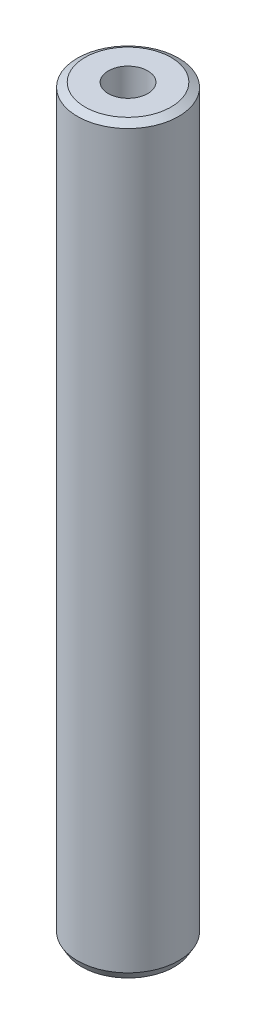
from build123d import *
from OCP.BRepFilletAPI import BRepFilletAPI_MakeChamfer

# Parameters (mm, degrees)
SKETCH1_R           = 37.5
BOSS_EXTRUDE1_DEPTH = 550.928941752
SKETCH2_R           = 14.639786321
CUT_EXTRUDE1_DEPTH  = 554.475563019
CHAMFER1_SIZE       = 3.236210435
CHAMFER1_SIZE2      = 5.605280897


with BuildPart() as part:
    # Sketch1 → Boss-Extrude1 (new body)
    with BuildSketch(Plane(origin=(0, 0, 0), x_dir=(1, 0, 0), z_dir=(0, 1, 0))):
        Circle(SKETCH1_R)
    extrude(amount=BOSS_EXTRUDE1_DEPTH)

    # Sketch2 → Cut-Extrude1 (cut, through all)
    with BuildSketch(Plane(origin=(0, 0, 0), x_dir=(1, 0, 0), z_dir=(0, 1, 0))):
        Circle(SKETCH2_R)
    extrude(amount=CUT_EXTRUDE1_DEPTH, mode=Mode.SUBTRACT)

    # Chamfer1: one chamfer whose edges measure the first distance from different faces: ONE call of the kernel's chamfer builder (chamfer() names one face for all edges)
    chamfer1_edges_1 = [part.edges().sort_by_distance(p)[0] for p in [
        (-37.5, 550.928941752, 0),
    ]]
    chamfer1_side_1 = [part.faces().sort_by_distance(p)[0] for p in [
        (-37.5, 275.464470876, 0),
    ]]
    chamfer1_edges_2 = [part.edges().sort_by_distance(p)[0] for p in [
        (-37.5, 0, 0),
    ]]
    chamfer1_side_2 = [part.faces().sort_by_distance(p)[0] for p in [
        (-36.439339828, 0, 0),
    ]]
    chamfer1 = BRepFilletAPI_MakeChamfer(part.part.solid().wrapped)
    for e in chamfer1_edges_1:
        chamfer1.Add(CHAMFER1_SIZE, CHAMFER1_SIZE2, e.wrapped, chamfer1_side_1[0].wrapped)  # the first distance lies on this face
    for e in chamfer1_edges_2:
        chamfer1.Add(CHAMFER1_SIZE, CHAMFER1_SIZE2, e.wrapped, chamfer1_side_2[0].wrapped)  # the first distance lies on this face
    add(Compound.cast(chamfer1.Shape()), mode=Mode.REPLACE)


solid = part.part
